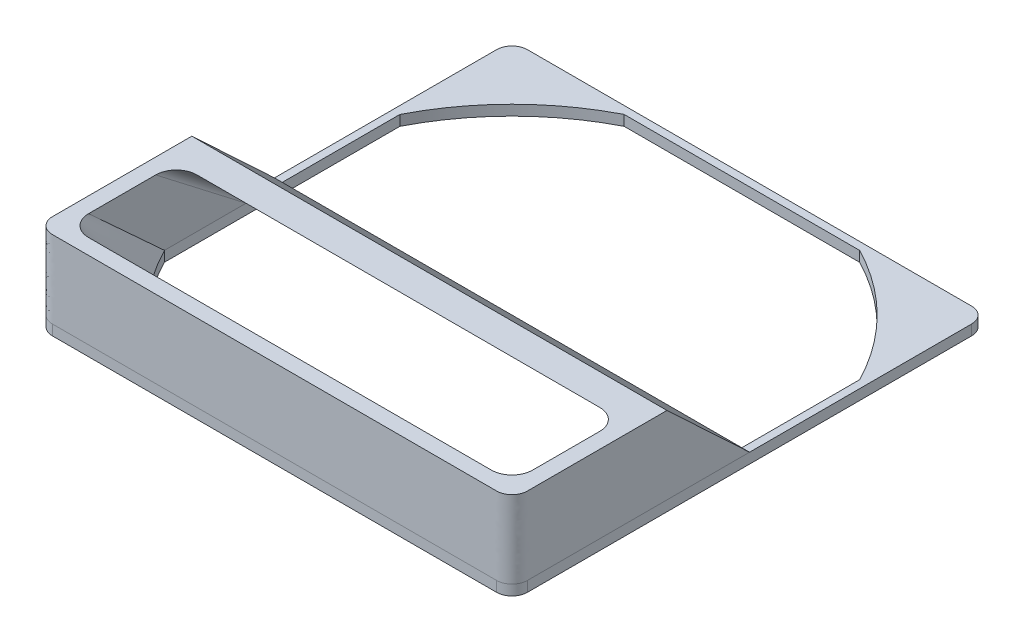
from build123d import *

# Parameters (mm, degrees)
SALIENTE_EXTRUIR1_DEPTH = 2


with BuildPart() as part:
    # Croquis1 → Saliente-Extruir1 (new body)
    with BuildSketch(Plane(origin=(0, 0, 0), x_dir=(1, 0, 0), z_dir=(0, 1, 0))):
        with BuildLine():
            Line((-43, -46), (43, -46))
            ThreePointArc((43, -46), (45.121320344, -45.121320344), (46, -43))
            Line((46, -43), (46, 43))
            ThreePointArc((46, 43), (45.121320344, 45.121320344), (43, 46))
            Line((43, 46), (-43, 46))
            ThreePointArc((-43, 46), (-45.121320344, 45.121320344), (-46, 43))
            Line((-46, 43), (-46, -43))
            ThreePointArc((-46, -43), (-45.121320344, -45.121320344), (-43, -46))
        make_face()
        with BuildLine():
            Line((-22.79802623, 44.5), (22.79802623, 44.5))
            ThreePointArc((22.79802623, 44.5), (35.355339059, 35.355339059), (44.5, 22.79802623))
            Line((44.5, 22.79802623), (44.5, -22.79802623))
            ThreePointArc((44.5, -22.79802623), (35.355339059, -35.355339059), (22.79802623, -44.5))
            Line((22.79802623, -44.5), (-22.79802623, -44.5))
            ThreePointArc((-22.79802623, -44.5), (-35.355339059, -35.355339059), (-44.5, -22.79802623))
            Line((-44.5, -22.79802623), (-44.5, 22.79802623))
            ThreePointArc((-44.5, 22.79802623), (-35.355339059, 35.355339059), (-22.79802623, 44.5))
        make_face(mode=Mode.SUBTRACT)
    extrude(amount=SALIENTE_EXTRUIR1_DEPTH)

    # Recubrir2: read off the stored shape, not the designer's step
    # Recubrir2: loft between two sections, ruled curve by curve
    recubrir2_from = [
        Edge.make_bspline([(-46, 2, 0), (-46, 2, 3.583333333), (-46, 2, 10.793843818), (-46, 2, 21.642929413), (-46, 2, 32.423708324), (-46, 2, 39.501757631), (-46, 2, 43.477790042), (-45.783671462, 2, 44.311725412), (-45.092534915, 2, 45.246778084), (-44.142540647, 2, 45.847617023), (-43.392699079, 2, 46), (-35.833333333, 2, 46), (-21.5, 2, 46), (0, 2, 46), (21.5, 2, 46), (35.833333333, 2, 46), (43.392699079, 2, 46), (44.142540647, 2, 45.847617023), (45.092534915, 2, 45.246778084), (45.783671462, 2, 44.311725412), (46, 2, 43.477790042), (46, 2, 39.501757631), (46, 2, 32.423708324), (46, 2, 21.642929413), (46, 2, 10.793843818), (46, 2, 3.583333333), (46, 2, 0)], [0, 0, 0, 0, 0.05245804, 0.104916079, 0.157374119, 0.209832158, 0.209832158, 0.216996879, 0.224161599, 0.23132632, 0.23849104, 0.23849104, 0.36924552, 0.5, 0.63075448, 0.76150896, 0.76150896, 0.76867368, 0.775838401, 0.783003121, 0.790167842, 0.790167842, 0.842625881, 0.895083921, 0.94754196, 1, 1, 1, 1], 3),
        Edge.make_line((46, 2, 0), (-46, 2, 0)),
    ]
    recubrir2_to = [
        Edge.make_bspline([(-46, 17, 16), (-46, 17, 18.25), (-46, 17, 22.713944004), (-46, 17, 29.383243466), (-46, 17, 36.10404607), (-46, 17, 40.674867573), (-46, 17, 43.317566653), (-45.899436706, 17, 44.004571477), (-45.303026141, 17, 45.060653885), (-44.230949162, 17, 45.840096066), (-43.392699079, 17, 46), (-35.833333333, 17, 46), (-21.5, 17, 46), (0, 17, 46), (21.5, 17, 46), (35.833333333, 17, 46), (43.392699079, 17, 46), (44.230949162, 17, 45.840096066), (45.303026141, 17, 45.060653885), (45.899436706, 17, 44.004571477), (46, 17, 43.317566653), (46, 17, 40.674867573), (46, 17, 36.10404607), (46, 17, 29.383243466), (46, 17, 22.713944004), (46, 17, 18.25), (46, 17, 16)], [0, 0, 0, 0, 0.05245804, 0.104916079, 0.157374119, 0.209832158, 0.209832158, 0.216996879, 0.224161599, 0.23132632, 0.23849104, 0.23849104, 0.36924552, 0.5, 0.63075448, 0.76150896, 0.76150896, 0.76867368, 0.775838401, 0.783003121, 0.790167842, 0.790167842, 0.842625881, 0.895083921, 0.94754196, 1, 1, 1, 1], 3),
        Edge.make_line((46, 17, 16), (-46, 17, 16)),
    ]
    recubrir2 = Solid(Shell([*[Face.make_surface_from_curves(recubrir2_from[k], recubrir2_to[k]) for k in range(2)], Face(Wire(recubrir2_from)), Face(Wire(recubrir2_to))]))
    add(recubrir2)

    # Croquis3 for Cortar-Recub → Cortar-Recubrir1 section 0
    with BuildSketch(Plane(origin=(0, 17, 0), x_dir=(1, 0, 0), z_dir=(0, 1, 0))):
        with BuildLine():
            Line((-43, -39), (-43, -26))
            # circular arc as an exact rational Bezier (weights 1, cos(half-angle), 1)
            Bezier((-43, -26), (-43, -22), (-39, -22), weights=[1, 0.707106781, 1])
            Line((-39, -22), (39, -22))
            Bezier((39, -22), (43, -22), (43, -26), weights=[1, 0.707106781, 1])
            Line((43, -26), (43, -39))
            Bezier((43, -39), (43, -43), (39, -43), weights=[1, 0.707106781, 1])
            Line((39, -43), (-39, -43))
            Bezier((-39, -43), (-43, -43), (-43, -39), weights=[1, 0.707106781, 1])
        make_face()
    # Croquis5 for Cortar-Recub → Cortar-Recubrir1 section 1
    with BuildSketch(Plane(origin=(0, 2, 0), x_dir=(1, 0, 0), z_dir=(0, 1, 0))):
        with BuildLine():
            Line((44.5, -22.79802623), (44.5, -7))
            Bezier((44.5, -7), (44.5, -3), (40.5, -3), weights=[1, 0.707106781, 1])
            Line((40.5, -3), (-40.5, -3))
            Bezier((-40.5, -3), (-44.5, -3), (-44.5, -7), weights=[1, 0.707106781, 1])
            Line((-44.5, -7), (-44.5, -22.79802623))
            Bezier((-44.5, -22.79802623), (-37.148192006, -37.148192006), (-22.79802623, -44.5), weights=[1, 0.951737814, 1])
            Line((-22.79802623, -44.5), (22.79802623, -44.5))
            Bezier((22.79802623, -44.5), (37.148192006, -37.148192006), (44.5, -22.79802623), weights=[1, 0.951737814, 1])
        make_face()
    loft(mode=Mode.SUBTRACT)


solid = part.part
